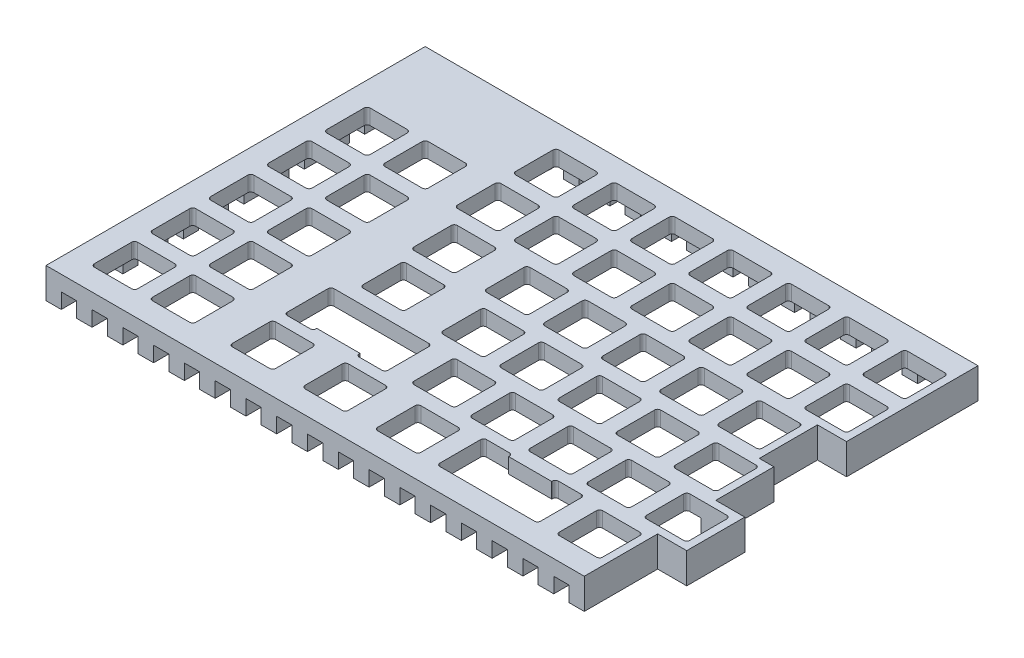
from build123d import *

# Parameters (mm, degrees)
PLATE_FRAME_DEPTH    = 5
CUT_EXTRUDE_1U_DEPTH = 224.745817
CUT_EXTRUDE1_DEPTH   = 224.745817
CUT_EXTRUDE2_DEPTH   = 224.745817
BOSS_EXTRUDE1_DEPTH  = 5
CUT_EXTRUDE5_REACH   = 225.746
SKETCH9_W            = 5
SKETCH9_H            = 5
SKETCH10_W           = 5
SKETCH10_H           = 5
CUT_EXTRUDE6_DEPTH   = 224.745817


with BuildPart() as part:
    # Sketch1 → Plate Frame (new body)
    with BuildSketch(Plane(origin=(0, 0, 0), x_dir=(1, 0, 0), z_dir=(0, 1, 0))):
        Polygon((0, 0), (0, 124.3), (181.2125, 124.3), (181.2125, 81.2), (171.6875, 81.2), (171.6875, 62.15), (176.45, 62.15), (176.45, 43.1), (185.975, 43.1), (185.975, 24.05), (176.45, 24.05), (176.45, 0), align=None)
    extrude(amount=PLATE_FRAME_DEPTH)

    # Sketch2 → Cut-Extrude 1U (cut, through all)
    with BuildSketch(Plane(origin=(0, 5, 0), x_dir=(1, 0, 0), z_dir=(0, 1, 0))):
        with BuildLine():
            Line((7.425, 8.425), (7.425, 20.625))
            ThreePointArc((7.425, 20.625), (7.717893219, 21.332106781), (8.425, 21.625))
            Line((8.425, 21.625), (20.625, 21.625))
            ThreePointArc((20.625, 21.625), (21.332106781, 21.332106781), (21.625, 20.625))
            Line((21.625, 20.625), (21.625, 8.425))
            ThreePointArc((21.625, 8.425), (21.332106781, 7.717893219), (20.625, 7.425))
            Line((20.625, 7.425), (8.425, 7.425))
            ThreePointArc((8.425, 7.425), (7.717893219, 7.717893219), (7.425, 8.425))
        make_face()
    cut_extrude_1u = extrude(amount=-CUT_EXTRUDE_1U_DEPTH, mode=Mode.SUBTRACT)

    # Sketch-Pattern1: Cut-Extrude 1U at 44 more places
    with Locations((19.05, 0, 0), (19.05, 0, -19.05), (0, 0, -19.05), (0, 0, -38.1), (19.05, 0, -38.1), (19.05, 0, -57.15), (0, 0, -57.15), (0, 0, -76.2), (19.05, 0, -76.2), (42.8625, 0, -95.25), (42.8625, 0, -76.2), (61.9125, 0, -76.2), (61.9125, 0, -95.25), (80.9625, 0, -95.25), (80.9625, 0, -76.2), (100.0125, 0, -76.2), (100.0125, 0, -95.25), (119.0625, 0, -95.25), (119.0625, 0, -76.2), (138.1125, 0, -76.2), (138.1125, 0, -95.25), (157.1625, 0, -95.25), (157.1625, 0, -76.2), (71.4375, 0, -57.15), (47.625, 0, -57.15), (90.4875, 0, -57.15), (109.5375, 0, -57.15), (128.5875, 0, -57.15), (147.6375, 0, -57.15), (76.2, 0, -38.1), (95.25, 0, -38.1), (114.3, 0, -38.1), (133.35, 0, -38.1), (152.4, 0, -38.1), (85.725, 0, -19.05), (104.775, 0, -19.05), (123.825, 0, -19.05), (142.875, 0, -19.05), (161.925, 0, -19.05), (69.05625, 0, 0), (92.86875, 0, 0), (50.00625, 0, -38.1), (152.4, 0, 0), (45.24375, 0, 0)):
        add(cut_extrude_1u, mode=Mode.SUBTRACT)

    # Sketch6 → Cut-Extrude1 (cut, through all)
    with BuildSketch(Plane(origin=(0, 5, 0), x_dir=(1, 0, 0), z_dir=(0, 1, 0))):
        with BuildLine():
            Line((52.79375, 26.325), (52.79375, 39.625))
            ThreePointArc((52.79375, 39.625), (53.086643219, 40.332106781), (53.79375, 40.625))
            Line((53.79375, 40.625), (84.79375, 40.625))
            ThreePointArc((84.79375, 40.625), (85.500856781, 40.332106781), (85.79375, 39.625))
            Line((85.79375, 39.625), (85.79375, 26.325))
            ThreePointArc((85.79375, 26.325), (85.500856781, 25.617893219), (84.79375, 25.325))
            Line((84.79375, 25.325), (77.34375, 25.325))
            ThreePointArc((77.34375, 25.325), (76.636643219, 25.617893219), (76.34375, 26.325))
            Line((76.34375, 26.325), (76.34375, 26.525))
            Line((76.34375, 26.525), (62.24375, 26.525))
            Line((62.24375, 26.525), (62.24375, 26.325))
            ThreePointArc((62.24375, 26.325), (61.950856781, 25.617893219), (61.24375, 25.325))
            Line((61.24375, 25.325), (53.79375, 25.325))
            ThreePointArc((53.79375, 25.325), (53.086643219, 25.617893219), (52.79375, 26.325))
        make_face()
    extrude(amount=-CUT_EXTRUDE1_DEPTH, mode=Mode.SUBTRACT)

    # Sketch7 → Cut-Extrude2 (cut, through all)
    with BuildSketch(Plane(origin=(0, 5, 0), x_dir=(1, 0, 0), z_dir=(0, 1, 0))):
        with BuildLine():
            Line((121.659375, 7.475), (152.659375, 7.475))
            ThreePointArc((152.659375, 7.475), (153.366481781, 7.767893219), (153.659375, 8.475))
            Line((153.659375, 8.475), (153.659375, 21.775))
            ThreePointArc((153.659375, 21.775), (153.366481781, 22.482106781), (152.659375, 22.775))
            Line((152.659375, 22.775), (145.209375, 22.775))
            ThreePointArc((145.209375, 22.775), (144.502268219, 22.482106781), (144.209375, 21.775))
            Line((144.209375, 21.775), (144.209375, 21.575))
            Line((144.209375, 21.575), (130.109375, 21.575))
            Line((130.109375, 21.575), (130.109375, 21.775))
            ThreePointArc((130.109375, 21.775), (129.816481781, 22.482106781), (129.109375, 22.775))
            Line((129.109375, 22.775), (121.659375, 22.775))
            ThreePointArc((121.659375, 22.775), (120.952268219, 22.482106781), (120.659375, 21.775))
            Line((120.659375, 21.775), (120.659375, 8.475))
            ThreePointArc((120.659375, 8.475), (120.952268219, 7.767893219), (121.659375, 7.475))
        make_face()
    extrude(amount=-CUT_EXTRUDE2_DEPTH, mode=Mode.SUBTRACT)

    # Sketch8 → Boss-Extrude1 (add)
    with BuildSketch(Plane.XZ):
        Polygon((176.45, 0), (0, 0), (0, -124.3), (181.2125, -124.3), (181.2125, -81.2), (171.6875, -81.2), (171.6875, -62.15), (176.45, -62.15), (176.45, -43.1), (185.975, -43.1), (185.975, -24.05), (176.45, -24.05), align=None)
        Polygon((5, -5), (174.025, -5), (174.025, -26.475), (183.55, -26.475), (183.55, -40.675), (174.025, -40.675), (174.025, -59.725), (169.2625, -59.725), (169.2625, -83.625), (178.7875, -83.625), (178.7875, -119.3), (5, -119.3), align=None, mode=Mode.SUBTRACT)
    extrude(amount=BOSS_EXTRUDE1_DEPTH)

    # Sketch9 → Cut-Extrude5 (cut, up to next)
    with BuildSketch(Plane(origin=(0, 0, 0), x_dir=(0, 0, -1), z_dir=(1, 0, 0)), mode=Mode.PRIVATE) as cut_extrude5_sk1:
        with Locations((116.8, -2.5)):
            Rectangle(SKETCH9_W, SKETCH9_H)
    cut_extrude5_tool1 = extrude(cut_extrude5_sk1.sketch, amount=CUT_EXTRUDE5_REACH, mode=Mode.PRIVATE) & part.part
    # Sketch9 → Cut-Extrude5 (cut, up to next)
    with BuildSketch(Plane(origin=(0, 0, 0), x_dir=(0, 0, -1), z_dir=(1, 0, 0)), mode=Mode.PRIVATE) as cut_extrude5_sk2:
        with Locations((106.89, -2.5)):
            Rectangle(SKETCH9_W, SKETCH9_H)
    cut_extrude5_tool2 = extrude(cut_extrude5_sk2.sketch, amount=CUT_EXTRUDE5_REACH, mode=Mode.PRIVATE) & part.part
    # Sketch9 → Cut-Extrude5 (cut, up to next)
    with BuildSketch(Plane(origin=(0, 0, 0), x_dir=(0, 0, -1), z_dir=(1, 0, 0)), mode=Mode.PRIVATE) as cut_extrude5_sk3:
        with Locations((96.98, -2.5)):
            Rectangle(SKETCH9_W, SKETCH9_H)
    cut_extrude5_tool3 = extrude(cut_extrude5_sk3.sketch, amount=CUT_EXTRUDE5_REACH, mode=Mode.PRIVATE) & part.part
    # Sketch9 → Cut-Extrude5 (cut, up to next)
    with BuildSketch(Plane(origin=(0, 0, 0), x_dir=(0, 0, -1), z_dir=(1, 0, 0)), mode=Mode.PRIVATE) as cut_extrude5_sk4:
        with Locations((87.07, -2.5)):
            Rectangle(SKETCH9_W, SKETCH9_H)
    cut_extrude5_tool4 = extrude(cut_extrude5_sk4.sketch, amount=CUT_EXTRUDE5_REACH, mode=Mode.PRIVATE) & part.part
    # Sketch9 → Cut-Extrude5 (cut, up to next)
    with BuildSketch(Plane(origin=(0, 0, 0), x_dir=(0, 0, -1), z_dir=(1, 0, 0)), mode=Mode.PRIVATE) as cut_extrude5_sk5:
        with Locations((77.16, -2.5)):
            Rectangle(SKETCH9_W, SKETCH9_H)
    cut_extrude5_tool5 = extrude(cut_extrude5_sk5.sketch, amount=CUT_EXTRUDE5_REACH, mode=Mode.PRIVATE) & part.part
    # Sketch9 → Cut-Extrude5 (cut, up to next)
    with BuildSketch(Plane(origin=(0, 0, 0), x_dir=(0, 0, -1), z_dir=(1, 0, 0)), mode=Mode.PRIVATE) as cut_extrude5_sk6:
        with Locations((67.25, -2.5)):
            Rectangle(SKETCH9_W, SKETCH9_H)
    cut_extrude5_tool6 = extrude(cut_extrude5_sk6.sketch, amount=CUT_EXTRUDE5_REACH, mode=Mode.PRIVATE) & part.part
    # Sketch9 → Cut-Extrude5 (cut, up to next)
    with BuildSketch(Plane(origin=(0, 0, 0), x_dir=(0, 0, -1), z_dir=(1, 0, 0)), mode=Mode.PRIVATE) as cut_extrude5_sk7:
        with Locations((57.34, -2.5)):
            Rectangle(SKETCH9_W, SKETCH9_H)
    cut_extrude5_tool7 = extrude(cut_extrude5_sk7.sketch, amount=CUT_EXTRUDE5_REACH, mode=Mode.PRIVATE) & part.part
    # Sketch9 → Cut-Extrude5 (cut, up to next)
    with BuildSketch(Plane(origin=(0, 0, 0), x_dir=(0, 0, -1), z_dir=(1, 0, 0)), mode=Mode.PRIVATE) as cut_extrude5_sk8:
        with Locations((47.43, -2.5)):
            Rectangle(SKETCH9_W, SKETCH9_H)
    cut_extrude5_tool8 = extrude(cut_extrude5_sk8.sketch, amount=CUT_EXTRUDE5_REACH, mode=Mode.PRIVATE) & part.part
    # Sketch9 → Cut-Extrude5 (cut, up to next)
    with BuildSketch(Plane(origin=(0, 0, 0), x_dir=(0, 0, -1), z_dir=(1, 0, 0)), mode=Mode.PRIVATE) as cut_extrude5_sk9:
        with Locations((37.52, -2.5)):
            Rectangle(SKETCH9_W, SKETCH9_H)
    cut_extrude5_tool9 = extrude(cut_extrude5_sk9.sketch, amount=CUT_EXTRUDE5_REACH, mode=Mode.PRIVATE) & part.part
    # Sketch9 → Cut-Extrude5 (cut, up to next)
    with BuildSketch(Plane(origin=(0, 0, 0), x_dir=(0, 0, -1), z_dir=(1, 0, 0)), mode=Mode.PRIVATE) as cut_extrude5_sk10:
        with Locations((27.61, -2.5)):
            Rectangle(SKETCH9_W, SKETCH9_H)
    cut_extrude5_tool10 = extrude(cut_extrude5_sk10.sketch, amount=CUT_EXTRUDE5_REACH, mode=Mode.PRIVATE) & part.part
    # Sketch9 → Cut-Extrude5 (cut, up to next)
    with BuildSketch(Plane(origin=(0, 0, 0), x_dir=(0, 0, -1), z_dir=(1, 0, 0)), mode=Mode.PRIVATE) as cut_extrude5_sk11:
        with Locations((17.7, -2.5)):
            Rectangle(SKETCH9_W, SKETCH9_H)
    cut_extrude5_tool11 = extrude(cut_extrude5_sk11.sketch, amount=CUT_EXTRUDE5_REACH, mode=Mode.PRIVATE) & part.part
    # Sketch9 → Cut-Extrude5 (cut, up to next)
    with BuildSketch(Plane(origin=(0, 0, 0), x_dir=(0, 0, -1), z_dir=(1, 0, 0)), mode=Mode.PRIVATE) as cut_extrude5_sk12:
        with Locations((7.5, -2.5)):
            Rectangle(SKETCH9_W, SKETCH9_H)
    cut_extrude5_tool12 = extrude(cut_extrude5_sk12.sketch, amount=CUT_EXTRUDE5_REACH, mode=Mode.PRIVATE) & part.part
    add(cut_extrude5_tool1.solids().sort_by_distance((0, -2.5, -116.8))[0], mode=Mode.SUBTRACT)
    add(cut_extrude5_tool2.solids().sort_by_distance((0, -2.5, -106.89))[0], mode=Mode.SUBTRACT)
    add(cut_extrude5_tool3.solids().sort_by_distance((0, -2.5, -96.98))[0], mode=Mode.SUBTRACT)
    add(cut_extrude5_tool4.solids().sort_by_distance((0, -2.5, -87.07))[0], mode=Mode.SUBTRACT)
    add(cut_extrude5_tool5.solids().sort_by_distance((0, -2.5, -77.16))[0], mode=Mode.SUBTRACT)
    add(cut_extrude5_tool6.solids().sort_by_distance((0, -2.5, -67.25))[0], mode=Mode.SUBTRACT)
    add(cut_extrude5_tool7.solids().sort_by_distance((0, -2.5, -57.34))[0], mode=Mode.SUBTRACT)
    add(cut_extrude5_tool8.solids().sort_by_distance((0, -2.5, -47.43))[0], mode=Mode.SUBTRACT)
    add(cut_extrude5_tool9.solids().sort_by_distance((0, -2.5, -37.52))[0], mode=Mode.SUBTRACT)
    add(cut_extrude5_tool10.solids().sort_by_distance((0, -2.5, -27.61))[0], mode=Mode.SUBTRACT)
    add(cut_extrude5_tool11.solids().sort_by_distance((0, -2.5, -17.7))[0], mode=Mode.SUBTRACT)
    add(cut_extrude5_tool12.solids().sort_by_distance((0, -2.5, -7.5))[0], mode=Mode.SUBTRACT)

    # Sketch10 → Cut-Extrude6 (cut, through all)
    with BuildSketch(Plane.XY):
        with Locations((7.5, -2.5)):
            Rectangle(SKETCH10_W, SKETCH10_H)
        with Locations((17.59, -2.5)):
            Rectangle(SKETCH10_W, SKETCH10_H)
        with Locations((27.68, -2.5)):
            Rectangle(SKETCH10_W, SKETCH10_H)
        with Locations((37.77, -2.5)):
            Rectangle(SKETCH10_W, SKETCH10_H)
        with Locations((47.86, -2.5)):
            Rectangle(SKETCH10_W, SKETCH10_H)
        with Locations((57.95, -2.5)):
            Rectangle(SKETCH10_W, SKETCH10_H)
        with Locations((68.04, -2.5)):
            Rectangle(SKETCH10_W, SKETCH10_H)
        with Locations((78.13, -2.5)):
            Rectangle(SKETCH10_W, SKETCH10_H)
        with Locations((88.22, -2.5)):
            Rectangle(SKETCH10_W, SKETCH10_H)
        with Locations((98.31, -2.5)):
            Rectangle(SKETCH10_W, SKETCH10_H)
        with Locations((108.4, -2.5)):
            Rectangle(SKETCH10_W, SKETCH10_H)
        with Locations((118.49, -2.5)):
            Rectangle(SKETCH10_W, SKETCH10_H)
        with Locations((128.58, -2.5)):
            Rectangle(SKETCH10_W, SKETCH10_H)
        with Locations((138.67, -2.5)):
            Rectangle(SKETCH10_W, SKETCH10_H)
        with Locations((148.76, -2.5)):
            Rectangle(SKETCH10_W, SKETCH10_H)
        with Locations((158.85, -2.5)):
            Rectangle(SKETCH10_W, SKETCH10_H)
        with Locations((168.95, -2.5)):
            Rectangle(SKETCH10_W, SKETCH10_H)
    extrude(amount=-CUT_EXTRUDE6_DEPTH, mode=Mode.SUBTRACT)


solid = part.part
